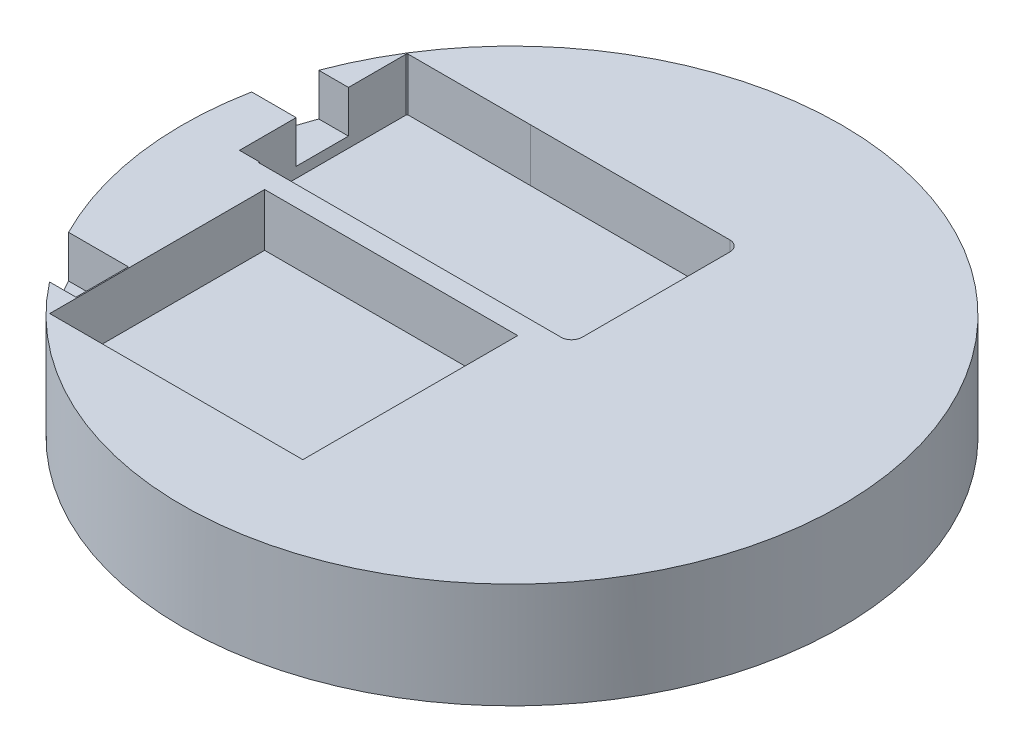
from build123d import *

# Parameters (mm, degrees)
SKETCH1_R           = 79.375
BOSS_EXTRUDE1_DEPTH = 25.4
SKETCH2_W           = 60.96
SKETCH2_H           = 51.7652
CUT_EXTRUDE1_DEPTH  = 12.7
SKETCH3_W           = 14.420421955
SKETCH3_H           = 12.64457884
CUT_EXTRUDE2_DEPTH  = 10.16


with BuildPart() as part:
    # Sketch1 → Boss-Extrude1 (new body)
    with BuildSketch(Plane(origin=(0, 0, 0), x_dir=(1, 0, 0), z_dir=(0, 1, 0))):
        Circle(SKETCH1_R)
    extrude(amount=BOSS_EXTRUDE1_DEPTH)

    # Sketch2 → Cut-Extrude1 (cut)
    with BuildSketch(Plane(origin=(0, 25.4, 0), x_dir=(1, 0, 0), z_dir=(0, 1, 0))):
        with BuildLine():
            Line((13.069814764, 3.833138394), (13.069814764, 39.393138394))
            ThreePointArc((13.069814764, 39.393138394), (12.325865988, 41.189189618), (10.529814764, 41.933138394))
            Line((10.529814764, 41.933138394), (-37.475874266, 41.933138394))
            Line((-37.475874266, 41.933138394), (-66.939875034, 41.933134494))
            Line((-66.939875034, 41.933134494), (-67.193874266, 41.679138428))
            Line((-67.193874266, 41.679138428), (-67.193874266, 1.547138394))
            Line((-67.193874266, 1.547138394), (-62.426979393, 1.547138394))
            Line((-62.426979393, 1.547138394), (-62.366588392, 1.293138394))
            Line((-62.366588392, 1.293138394), (10.529814764, 1.293138394))
            ThreePointArc((10.529814764, 1.293138394), (12.325865988, 2.03708717), (13.069814764, 3.833138394))
        make_face()
        with Locations((-25.51903083, -29.466261606)):
            Rectangle(SKETCH2_W, SKETCH2_H)
    extrude(amount=-CUT_EXTRUDE1_DEPTH, mode=Mode.SUBTRACT)

    # Sketch3 → Cut-Extrude2 (cut)
    with BuildSketch(Plane(origin=(0, 25.4, 0), x_dir=(1, 0, 0), z_dir=(0, 1, 0))):
        Polygon((-74.346901307, 27.801598715), (-67.193874266, 27.801598715), (-67.193874266, 15.203832007), (-74.346901307, 15.203832007), (-82.990691988, 15.203832007), (-82.990691988, 27.801598715), align=None)
        with Locations((-63.465097159, -42.452490705)):
            Rectangle(SKETCH3_W, SKETCH3_H)
    extrude(amount=-CUT_EXTRUDE2_DEPTH, mode=Mode.SUBTRACT)


solid = part.part
